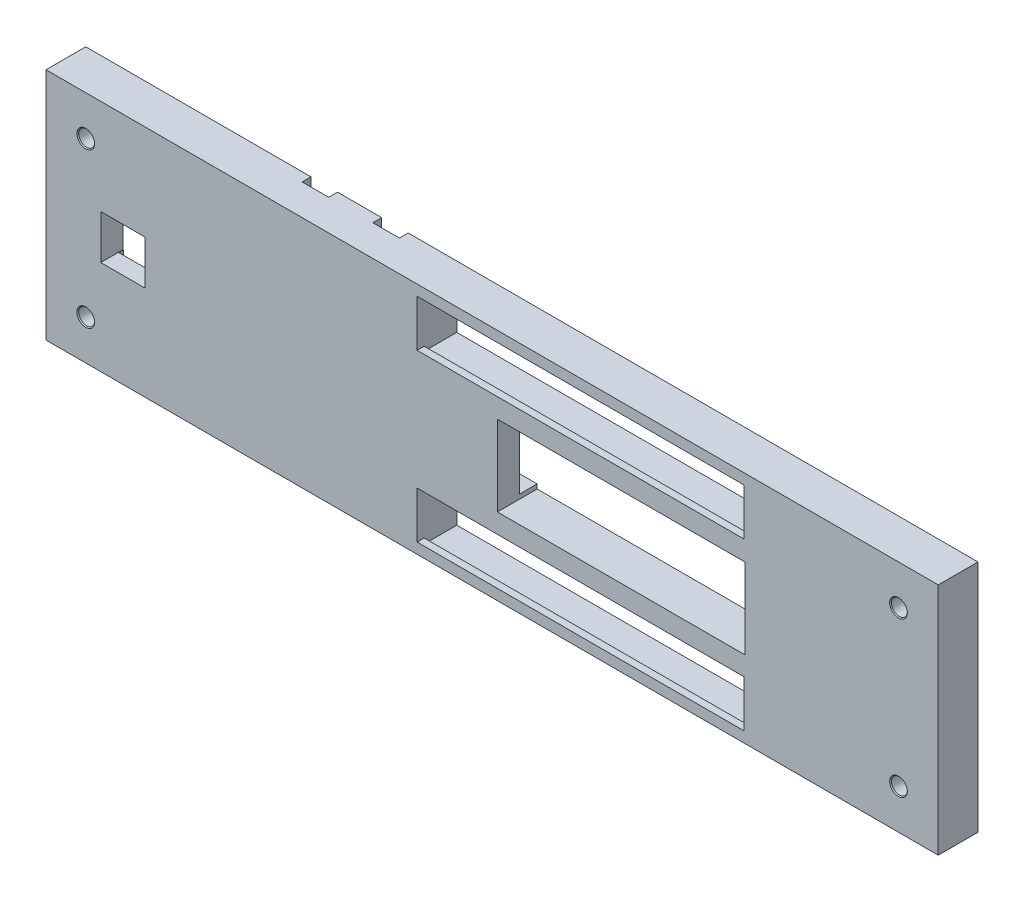
from build123d import *

# Parameters (mm, degrees)
SKETCH_1_W                   = 101
SKETCH_1_H                   = 26.5
EXTRUDE_1_DEPTH              = 2.5
SKETCH_10_W                  = 37
SKETCH_10_H                  = 7
CUT_EXTRUDE_1_DEPTH          = 2.5
EXTRUDE_2_DEPTH              = 2
HOLE_WIZARD_M6_4_D           = 1.8
HOLE_WIZARD_M6_4_CSINK_D     = 2
HOLE_WIZARD_M6_4_CSINK_ANGLE = 90
EXTRUDE_START                = 2
SKETCH_17_W                  = 4
SKETCH_17_H                  = 4
SKETCH_17_R                  = 0.9
EXTRUDE_3_DEPTH              = 2
SKETCH_18_W                  = 42.1
SKETCH_18_H                  = 9.1
CUT_EXTRUDE_2_DEPTH          = 1
CUT_EXTRUDE_3_REACH          = 106.477
SKETCH_20_W                  = 28
SKETCH_20_H                  = 9.1
SKETCH_22_W                  = 0.8
SKETCH_22_H                  = 0.5
EXTRUDE_4_DEPTH              = 37
EXTRUDE_5_DEPTH              = 1
SKETCH_24_W                  = 10
SKETCH_24_H                  = 2.5
SKETCH_24_W_2                = 3
SKETCH_24_H_2                = 1
CUT_EXTRUDE_4_DEPTH          = 15
CHAMFER_1_SIZE               = 2
CUT_EXTRUDE_5_REACH          = 106.449
SKETCH_25_W                  = 3
SKETCH_25_H                  = 1
SKETCH_27_W                  = 5
SKETCH_27_H                  = 5
CUT_EXTRUDE_6_DEPTH          = 9
SKETCH_28_W                  = 15
SKETCH_28_H                  = 1
SKETCH_28_W_2                = 23.55
CUT_EXTRUDE_7_DEPTH          = 2


with BuildPart() as part:
    # 草图1 → 凸台-拉伸1 (new body)
    with BuildSketch(Plane.XY):
        with Locations((50.5, 13.25)):
            Rectangle(SKETCH_1_W, SKETCH_1_H)
    extrude(amount=EXTRUDE_1_DEPTH)

    # 草图10 → 切除-拉伸1 (cut)
    with BuildSketch(Plane.XY.offset(2.5)):
        with Locations((60.5, 23)):
            Rectangle(SKETCH_10_W, SKETCH_10_H)
        with Locations((60.5, 3.5)):
            Rectangle(SKETCH_10_W, SKETCH_10_H)
    extrude(amount=-CUT_EXTRUDE_1_DEPTH, mode=Mode.SUBTRACT)

    # 草图11 → 凸台-拉伸2 (add)
    with BuildSketch(Plane(origin=(0, 0, 0), x_dir=(-1, 0, 0), z_dir=(0, 0, -1))):
        Polygon((-42, 26.5), (-42, 19.5), (-79, 19.5), (-79, 26.5), (-101, 26.5), (-101, 0), (-79, 0), (-79, 7), (-42, 7), (-42, 0), (0, 0), (0, 26.5), align=None)
        Polygon((-39.8, 24.3), (-39.8, 17.3), (-81.2, 17.3), (-81.2, 24.3), (-98.8, 24.3), (-98.8, 2.2), (-81.2, 2.2), (-81.2, 9.2), (-39.8, 9.2), (-39.8, 2.2), (-2.2, 2.2), (-2.2, 24.3), align=None, mode=Mode.SUBTRACT)
    extrude(amount=EXTRUDE_2_DEPTH)

    # M6 开槽半沉头螺钉的锥形沉头孔4 (through all)
    with Locations(Plane(origin=(0, 0, 2.5), x_dir=(-1, 0, 0), z_dir=(0, 0, 1))):
        with Locations((-4.5, -4.5), (-96.5, -22), (-96.5, -4.5), (-4.5, -22)):
            CounterSinkHole(HOLE_WIZARD_M6_4_D / 2, HOLE_WIZARD_M6_4_CSINK_D / 2, counter_sink_angle=HOLE_WIZARD_M6_4_CSINK_ANGLE)

    # 草图17 → 凸台-拉伸3 (add)
    # profile 1 of 4: a face of its own
    with BuildSketch(Plane(origin=(0, 0, 0), x_dir=(-1, 0, 0), z_dir=(0, 0, -1)).offset(EXTRUDE_START)):
        with Locations((-96.8, 22.3)):
            Rectangle(SKETCH_17_W, SKETCH_17_H)
        with Locations(Location((-96.5, 22, 0), (0, 0, 180))):
            Circle(SKETCH_17_R, mode=Mode.SUBTRACT)
    # profile 2 of 4: a face of its own
    with BuildSketch(Plane(origin=(0, 0, 0), x_dir=(-1, 0, 0), z_dir=(0, 0, -1)).offset(EXTRUDE_START)):
        with Locations((-96.8, 4.2)):
            Rectangle(SKETCH_17_W, SKETCH_17_H)
        with Locations(Location((-96.5, 4.5, 0), (0, 0, 180))):
            Circle(SKETCH_17_R, mode=Mode.SUBTRACT)
    # profile 3 of 4: a face of its own
    with BuildSketch(Plane(origin=(0, 0, 0), x_dir=(-1, 0, 0), z_dir=(0, 0, -1)).offset(EXTRUDE_START)):
        with Locations((-4.2, 22.3)):
            Rectangle(SKETCH_17_W, SKETCH_17_H)
        with Locations(Location((-4.5, 22, 0), (0, 0, 180))):
            Circle(SKETCH_17_R, mode=Mode.SUBTRACT)
    # profile 4 of 4: a face of its own
    with BuildSketch(Plane(origin=(0, 0, 0), x_dir=(-1, 0, 0), z_dir=(0, 0, -1)).offset(EXTRUDE_START)):
        with Locations((-4.2, 4.2)):
            Rectangle(SKETCH_17_W, SKETCH_17_H)
        with Locations(Location((-4.5, 4.5, 0), (0, 0, 180))):
            Circle(SKETCH_17_R, mode=Mode.SUBTRACT)
    extrude(amount=-EXTRUDE_3_DEPTH)

    # 草图18 → 切除-拉伸2 (cut)
    with BuildSketch(Plane.XY.offset(2.5)):
        Polygon((37, 8.7), (37, 17.8), (37, 19.5), (32, 19.5), (32, 7), (37, 7), align=None)
        with Locations((58.05, 13.25)):
            Rectangle(SKETCH_18_W, SKETCH_18_H)
        Polygon((79.1, 19.5), (79.1, 17.8), (79.1, 8.7), (79.1, 7), (84.1, 7), (84.1, 19.5), align=None)
    extrude(amount=-CUT_EXTRUDE_2_DEPTH, mode=Mode.SUBTRACT)

    # 草图20 → 切除-拉伸3 (cut, up to next)
    with BuildSketch(Plane.XY.offset(1.5), mode=Mode.PRIVATE) as cut_extrude_3_sk1:
        with Locations((65.1, 13.25)):
            Rectangle(SKETCH_20_W, SKETCH_20_H)
    cut_extrude_3_tool1 = extrude(cut_extrude_3_sk1.sketch, amount=-CUT_EXTRUDE_3_REACH, mode=Mode.PRIVATE) & part.part
    add(cut_extrude_3_tool1.solids().sort_by_distance((65.1, 13.25, 1.5))[0], mode=Mode.SUBTRACT)

    # 草图22 → 凸台-拉伸4 (add)
    with BuildSketch(Plane.ZY.offset(-79)):
        Polygon((-2, 26.5), (2.5, 26.5), (2.5, 25.35398434), (2.5, 25.3), (1.7, 25.3), (1.7, 25.9), (-2, 25.9), align=None)
        with Locations((2.1, 19.75)):
            Rectangle(SKETCH_22_W, SKETCH_22_H)
        with Locations((2.1, 6.75)):
            Rectangle(SKETCH_22_W, SKETCH_22_H)
        Polygon((-2, 0.6), (-2, 0), (2.5, 0), (2.5, 1.14601566), (2.5, 1.2), (1.7, 1.2), (1.7, 0.6), align=None)
    extrude(amount=EXTRUDE_4_DEPTH)

    # 草图23 → 凸台-拉伸5 (add)
    with BuildSketch(Plane.XY.offset(1.5)):
        Polygon((84.1, 7), (84.1, 19.5), (79.1, 19.5), (79.1, 17.8), (79.1, 8.7), (79.1, 7), align=None)
        Polygon((51.1, 8.7), (51.1, 17.8), (37, 17.8), (37, 19.5), (32, 19.5), (32, 7), (37, 7), (37, 8.7), align=None)
    extrude(amount=EXTRUDE_5_DEPTH)

    # 草图24 → 切除-拉伸4 (cut)
    with BuildSketch(Plane.XZ):
        with Locations((11.25, -0.75)):
            Rectangle(SKETCH_24_W, SKETCH_24_H)
        with Locations((19.75, -1.5)):
            Rectangle(SKETCH_24_W_2, SKETCH_24_H_2)
        with Locations((27.75, -1.5)):
            Rectangle(SKETCH_24_W_2, SKETCH_24_H_2)
        with Locations((35.75, -1.5)):
            Rectangle(SKETCH_24_W_2, SKETCH_24_H_2)
    extrude(amount=-CUT_EXTRUDE_4_DEPTH, mode=Mode.SUBTRACT)

    # 倒角1
    chamfer_1_edges = [part.edges().sort_by_distance(p)[0] for p in [
        (6.25, 0, -0.75),
        (16.25, 0, -0.75),
        (11.25, 0, 0.5),
    ]]
    chamfer(chamfer_1_edges, length=CHAMFER_1_SIZE - 0.0001)  # a hair under: the kernel refuses the full size

    # 草图25 → 切除-拉伸5 (cut, up to next)
    with BuildSketch(Plane(origin=(0, 26.5, 0), x_dir=(1, 0, 0), z_dir=(0, 1, 0)), mode=Mode.PRIVATE) as cut_extrude_5_sk1:
        with Locations((27, 1.5)):
            Rectangle(SKETCH_25_W, SKETCH_25_H)
    cut_extrude_5_tool1 = extrude(cut_extrude_5_sk1.sketch, amount=-CUT_EXTRUDE_5_REACH, mode=Mode.PRIVATE) & part.part
    # 草图25 → 切除-拉伸5 (cut, up to next)
    with BuildSketch(Plane(origin=(0, 26.5, 0), x_dir=(1, 0, 0), z_dir=(0, 1, 0)), mode=Mode.PRIVATE) as cut_extrude_5_sk2:
        with Locations((35, 1.5)):
            Rectangle(SKETCH_25_W, SKETCH_25_H)
    cut_extrude_5_tool2 = extrude(cut_extrude_5_sk2.sketch, amount=-CUT_EXTRUDE_5_REACH, mode=Mode.PRIVATE) & part.part
    add(cut_extrude_5_tool1.solids().sort_by_distance((27, 26.5, -1.5))[0], mode=Mode.SUBTRACT)
    add(cut_extrude_5_tool2.solids().sort_by_distance((35, 26.5, -1.5))[0], mode=Mode.SUBTRACT)

    # 草图27 → 切除-拉伸6 (cut)
    with BuildSketch(Plane(origin=(0, 0, 0), x_dir=(-1, 0, 0), z_dir=(0, 0, -1))):
        with Locations((-8.7, 13.2)):
            Rectangle(SKETCH_27_W, SKETCH_27_H)
    extrude(amount=-CUT_EXTRUDE_6_DEPTH, mode=Mode.SUBTRACT)

    # 草图28 → 切除-拉伸7 (cut)
    with BuildSketch(Plane(origin=(0, 0, -2), x_dir=(-1, 0, 0), z_dir=(0, 0, -1))):
        with Locations((-31.3, 24.8)):
            Rectangle(SKETCH_28_W, SKETCH_28_H)
        with Locations((-28.025, 1.7)):
            Rectangle(SKETCH_28_W_2, SKETCH_28_H)
    extrude(amount=-CUT_EXTRUDE_7_DEPTH, mode=Mode.SUBTRACT)


solid = part.part
